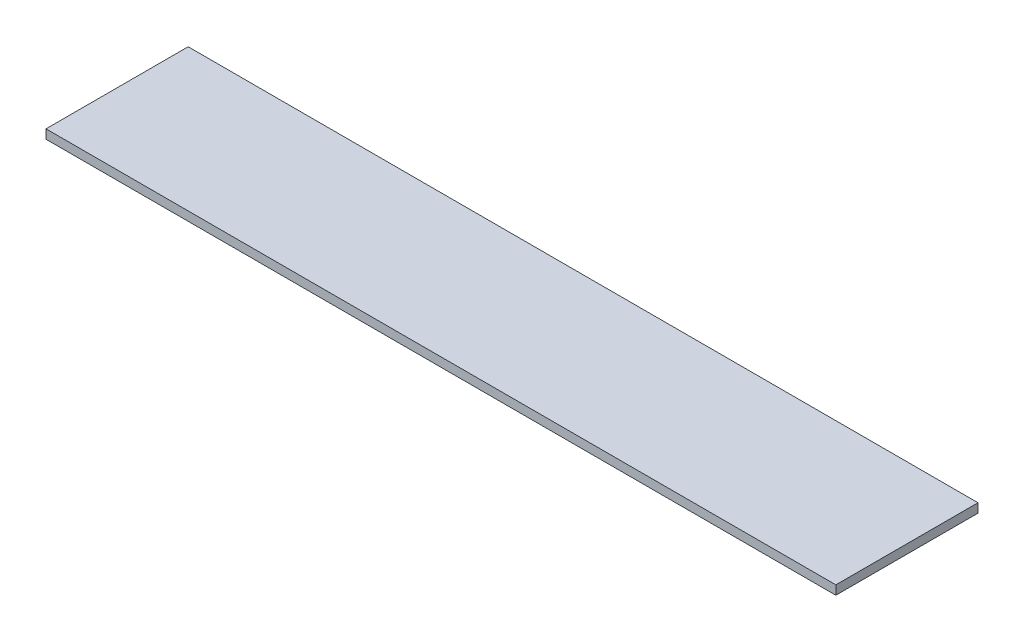
from build123d import *

# Parameters (mm, degrees)
SKETCH1_W          = 350
SKETCH1_H          = 63
BASE_FLANGE1_DEPTH = 4


# Sheet-metal steps are written as plain solids
with BuildPart() as part:
    # Sketch1 → Base-Flange1 (new body)
    with BuildSketch(Plane(origin=(0, 0, 0), x_dir=(1, 0, 0), z_dir=(0, 1, 0))):
        Rectangle(SKETCH1_W, SKETCH1_H)
    extrude(amount=-BASE_FLANGE1_DEPTH)


solid = part.part
